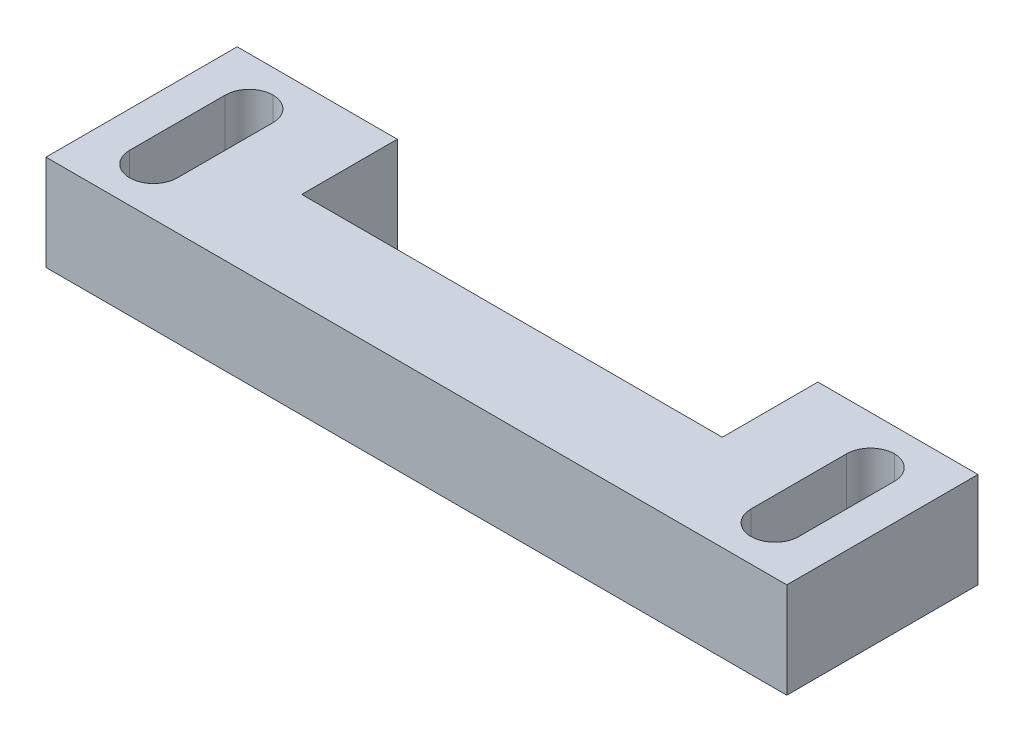
from build123d import *

# Parameters (mm, degrees)
SKETCH1_W            = 98.425
SKETCH1_H            = 12.7
BOSS_EXTRUDE1_DEPTH  = 12.7
CUT_EXTRUDE1_REACH   = 54.388
SKETCH2_W            = 6.35
SKETCH2_H            = 19.05
FILLET1_R            = 3.175
FILLET2_R            = 3.175
FILLET3_R            = 3.175
FILLET4_R            = 3.175
FILLET1_OF_MIRROR1_R = 3.175
FILLET2_OF_MIRROR1_R = 3.175
FILLET3_OF_MIRROR1_R = 3.175
FILLET4_OF_MIRROR1_R = 3.175
CUT_EXTRUDE2_REACH   = 54.388
SKETCH5_W            = 55.88
SKETCH5_H            = 12.7


with BuildPart() as part:
    # Sketch1 → Boss-Extrude1 (new, symmetric)
    with BuildSketch(Plane.XY):
        Rectangle(SKETCH1_W, SKETCH1_H)
    extrude(amount=BOSS_EXTRUDE1_DEPTH, both=True)

    # Sketch2 → Cut-Extrude1 (cut, up to next)
    with BuildSketch(Plane(origin=(0, 6.35, 0), x_dir=(1, 0, 0), z_dir=(0, 1, 0)), mode=Mode.PRIVATE) as cut_extrude1_sk1:
        with Locations((-41.275, 0)):
            Rectangle(SKETCH2_W, SKETCH2_H)
    cut_extrude1_tool1 = extrude(cut_extrude1_sk1.sketch, amount=-CUT_EXTRUDE1_REACH, mode=Mode.PRIVATE) & part.part
    cut_extrude1 = cut_extrude1_tool1.solids().sort_by_distance((-41.275, 6.35, 0))[0]
    add(cut_extrude1, mode=Mode.SUBTRACT)

    # Fillet1
    fillet1_edges = [part.edges().sort_by_distance(p)[0] for p in [
        (-44.45, 0, -9.525),
    ]]
    fillet(fillet1_edges, radius=FILLET1_R)

    # Fillet2
    fillet2_edges = [part.edges().sort_by_distance(p)[0] for p in [
        (-38.1, 0, -9.525),
    ]]
    fillet(fillet2_edges, radius=FILLET2_R - 0.0001)  # a hair under: the kernel refuses the full size

    # Fillet3
    fillet3_edges = [part.edges().sort_by_distance(p)[0] for p in [
        (-44.45, 0, 9.525),
    ]]
    fillet(fillet3_edges, radius=FILLET3_R)

    # Fillet4
    fillet4_edges = [part.edges().sort_by_distance(p)[0] for p in [
        (-38.1, 0, 9.525),
    ]]
    fillet(fillet4_edges, radius=FILLET4_R - 0.0001)  # a hair under: the kernel refuses the full size

    # Mirror1: Cut-Extrude1 across plane
    add(cut_extrude1.mirror(Plane(origin=(0, 0, 0), x_dir=(0, 0, 1), z_dir=(1, 0, 0))), mode=Mode.SUBTRACT)

    # Fillet1 of Mirror1
    fillet1_of_mirror1_edges = [part.edges().sort_by_distance(p)[0] for p in [
        (44.45, 0, -9.525),
    ]]
    fillet(fillet1_of_mirror1_edges, radius=FILLET1_OF_MIRROR1_R)

    # Fillet2 of Mirror1
    fillet2_of_mirror1_edges = [part.edges().sort_by_distance(p)[0] for p in [
        (38.1, 0, -9.525),
    ]]
    fillet(fillet2_of_mirror1_edges, radius=FILLET2_OF_MIRROR1_R - 0.0001)  # a hair under: the kernel refuses the full size

    # Fillet3 of Mirror1
    fillet3_of_mirror1_edges = [part.edges().sort_by_distance(p)[0] for p in [
        (44.45, 0, 9.525),
    ]]
    fillet(fillet3_of_mirror1_edges, radius=FILLET3_OF_MIRROR1_R)

    # Fillet4 of Mirror1
    fillet4_of_mirror1_edges = [part.edges().sort_by_distance(p)[0] for p in [
        (38.1, 0, 9.525),
    ]]
    fillet(fillet4_of_mirror1_edges, radius=FILLET4_OF_MIRROR1_R - 0.0001)  # a hair under: the kernel refuses the full size

    # Sketch5 → Cut-Extrude2 (cut, up to next)
    with BuildSketch(Plane(origin=(0, 6.35, 0), x_dir=(1, 0, 0), z_dir=(0, 1, 0)), mode=Mode.PRIVATE) as cut_extrude2_sk1:
        with Locations((0, 6.35)):
            Rectangle(SKETCH5_W, SKETCH5_H)
    cut_extrude2_tool1 = extrude(cut_extrude2_sk1.sketch, amount=-CUT_EXTRUDE2_REACH, mode=Mode.PRIVATE) & part.part
    add(cut_extrude2_tool1.solids().sort_by_distance((0, 6.35, -6.35))[0], mode=Mode.SUBTRACT)


solid = part.part
